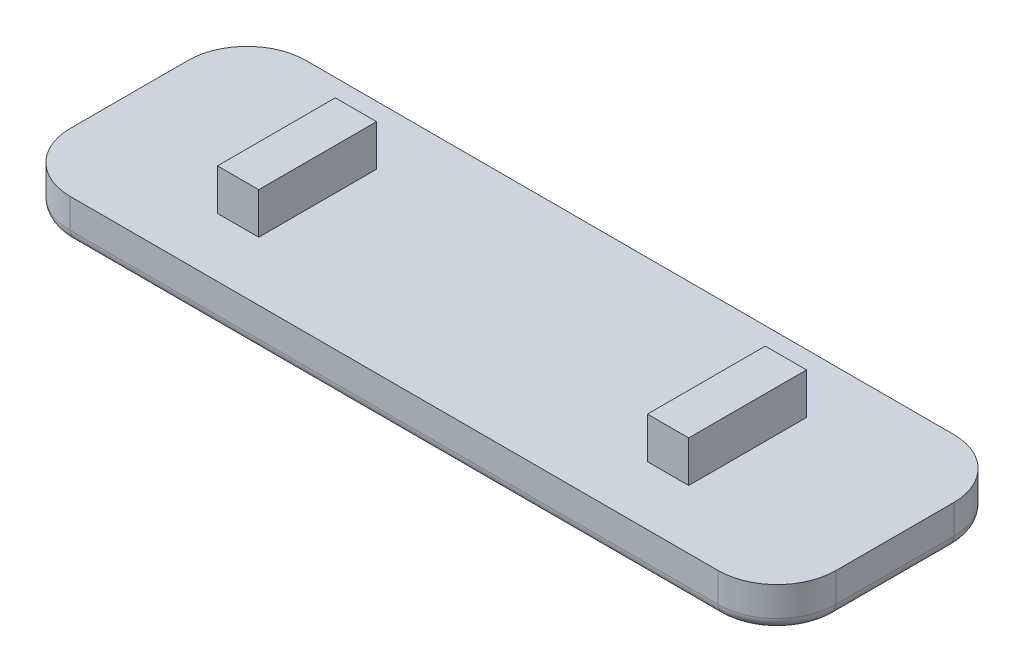
from build123d import *

# Parameters (mm, degrees)
BOSS_EXTRUDE1_DEPTH = 25.4
SKETCH2_W           = 165.1
SKETCH2_H           = 8.89
BOSS_EXTRUDE2_DEPTH = 12.7
SKETCH3_W           = 165.1
SKETCH3_H           = 8.89
BOSS_EXTRUDE3_DEPTH = 12.7
FILLET1_R           = 12.7
FILLET2_R           = 2.54


with BuildPart() as part:
    # Sketch1 → Boss-Extrude1 (new body)
    with BuildSketch(Plane.XY):
        Polygon((-50.8, 4.445), (-82.55, 4.445), (-82.55, -4.445), (82.55, -4.445), (82.55, 4.445), (50.8, 4.445), (50.8, 13.335), (41.91, 13.335), (41.91, 4.445), (-41.91, 4.445), (-41.91, 13.335), (-50.8, 13.335), align=None)
    extrude(amount=BOSS_EXTRUDE1_DEPTH)

    # Sketch2 → Boss-Extrude2 (add)
    with BuildSketch(Plane.XY.offset(25.4)):
        Rectangle(SKETCH2_W, SKETCH2_H)
    extrude(amount=BOSS_EXTRUDE2_DEPTH)

    # Sketch3 → Boss-Extrude3 (add)
    with BuildSketch(Plane(origin=(0, 0, 0), x_dir=(-1, 0, 0), z_dir=(0, 0, -1))):
        Rectangle(SKETCH3_W, SKETCH3_H)
    extrude(amount=BOSS_EXTRUDE3_DEPTH)

    # Fillet1
    fillet1_edges = [part.edges().sort_by_distance(p)[0] for p in [
        (82.55, 0, 38.1),
        (-82.55, 0, 38.1),
        (-82.55, 0, -12.7),
        (82.55, 0, -12.7),
    ]]
    fillet(fillet1_edges, radius=FILLET1_R)

    # Fillet2
    fillet2_edges = [part.edges().sort_by_distance(p)[0] for p in [
        (0, -4.445, -12.7),
        (-78.830256121, -4.445, -8.980256121),
        (-82.55, -4.445, 12.7),
        (-78.830256121, -4.445, 34.380256121),
        (0, -4.445, 38.1),
        (78.830256121, -4.445, 34.380256121),
        (82.55, -4.445, 12.7),
        (78.830256121, -4.445, -8.980256121),
    ]]
    fillet(fillet2_edges, radius=FILLET2_R)


solid = part.part
